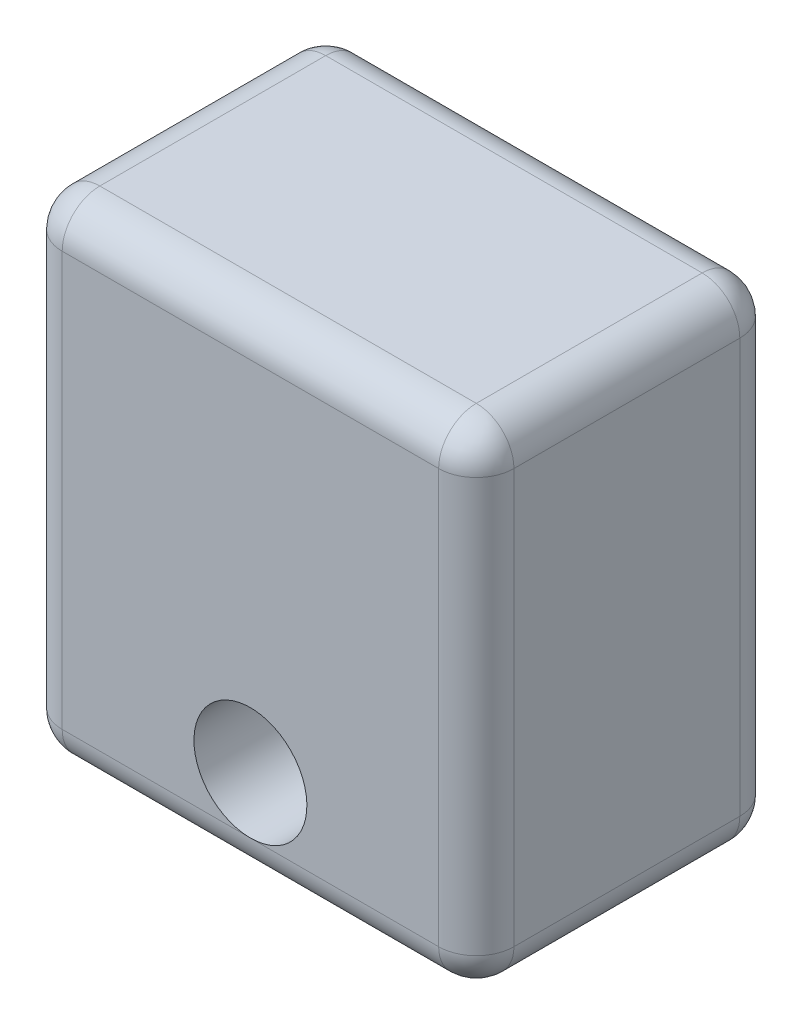
from build123d import *

# Parameters (mm, degrees)
SKETCH1_W           = 76.2
SKETCH1_H           = 82.55
SKETCH1_R           = 9.525
BOSS_EXTRUDE1_DEPTH = 25.4
SKETCH2_R           = 9.525
CUT_EXTRUDE1_DEPTH  = 50.8
FILLET1_R           = 6.35


with BuildPart() as part:
    # Sketch1 → Boss-Extrude1 (new, symmetric)
    with BuildSketch(Plane.XY):
        with Locations((0, 19.05)):
            Rectangle(SKETCH1_W, SKETCH1_H)
        with Locations((0, -6.35)):
            Circle(SKETCH1_R, mode=Mode.SUBTRACT)
    extrude(amount=BOSS_EXTRUDE1_DEPTH, both=True)

    # Sketch2 → Cut-Extrude1 (cut)
    with BuildSketch(Plane.ZY.offset(38.1)):
        with Locations((0, 44.45)):
            Circle(SKETCH2_R)
    extrude(amount=-CUT_EXTRUDE1_DEPTH, mode=Mode.SUBTRACT)

    # Fillet1
    fillet1_edges = [part.edges().sort_by_distance(p)[0] for p in [
        (-38.1, 19.05, 25.4),
        (0, -22.225, 25.4),
        (38.1, 19.05, 25.4),
        (0, -22.225, -25.4),
        (-38.1, 19.05, -25.4),
        (0, 60.325, -25.4),
        (38.1, 19.05, -25.4),
        (38.1, -22.225, 0),
        (-38.1, -22.225, 0),
        (-38.1, 60.325, 0),
        (38.1, 60.325, 0),
        (0, 60.325, 25.4),
    ]]
    fillet(fillet1_edges, radius=FILLET1_R - 0.0001)  # a hair under: the kernel refuses the full size


solid = part.part
